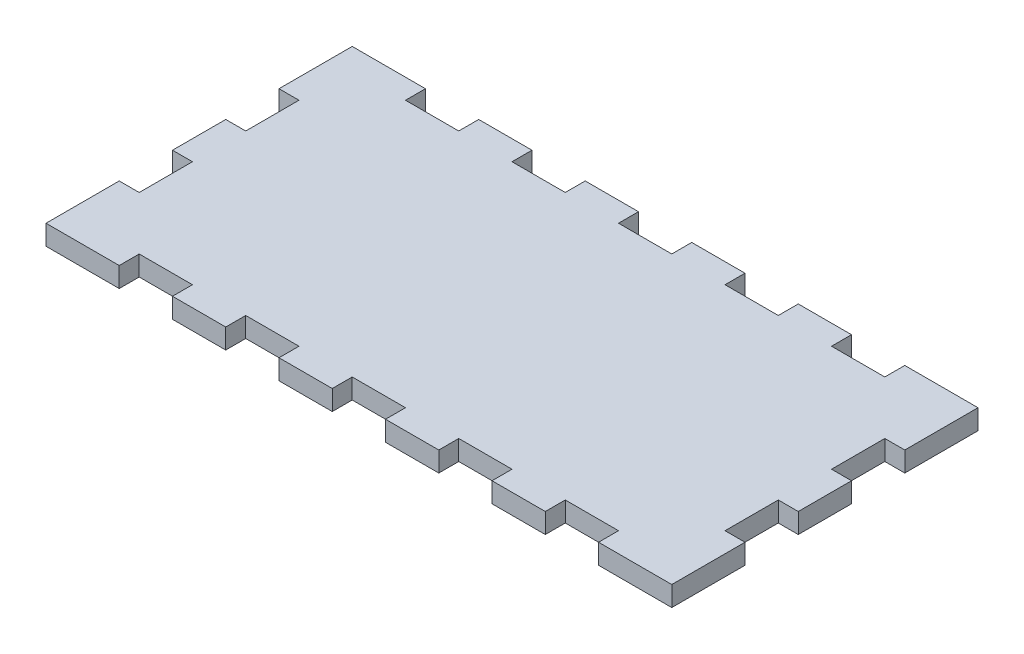
from build123d import *

# Parameters (mm, degrees)
SKETCH2_W               = 279.4
SKETCH2_H               = 127
BOSS_EXTRUDE1_DEPTH     = 9.525
SKETCH3_W               = 25.4
SKETCH3_H               = 9.525
BOSS_EXTRUDE2_DEPTH     = 9.525
LPATTERN1_COUNT         = 6
LPATTERN1_PITCH         = 50.8
MIRROR1_COPY_1_SKETCH_W = 25.4
MIRROR1_COPY_1_SKETCH_H = 9.525
MIRROR1_COPY_1_DEPTH    = 9.525
MIRROR1_COPY_2_SKETCH_W = 25.4
MIRROR1_COPY_2_SKETCH_H = 9.525
MIRROR1_COPY_2_DEPTH    = 9.525
MIRROR1_COPY_3_SKETCH_W = 25.4
MIRROR1_COPY_3_SKETCH_H = 9.525
MIRROR1_COPY_3_DEPTH    = 9.525
MIRROR1_COPY_4_SKETCH_W = 25.4
MIRROR1_COPY_4_SKETCH_H = 9.525
MIRROR1_COPY_4_DEPTH    = 9.525
MIRROR1_COPY_5_SKETCH_W = 25.4
MIRROR1_COPY_5_SKETCH_H = 9.525
MIRROR1_COPY_5_DEPTH    = 9.525
MIRROR1_COPY_6_SKETCH_W = 25.4
MIRROR1_COPY_6_SKETCH_H = 9.525
MIRROR1_COPY_6_DEPTH    = 9.525
SKETCH4_W               = 25.4
SKETCH4_H               = 9.525
BOSS_EXTRUDE3_DEPTH     = 9.525
LPATTERN2_COUNT         = 3
LPATTERN2_PITCH         = 50.8
MIRROR2_COPY_1_SKETCH_W = 25.4
MIRROR2_COPY_1_SKETCH_H = 9.525
MIRROR2_COPY_1_DEPTH    = 9.525
MIRROR2_COPY_2_SKETCH_W = 25.4
MIRROR2_COPY_2_SKETCH_H = 9.525
MIRROR2_COPY_2_DEPTH    = 9.525
MIRROR2_COPY_3_SKETCH_W = 25.4
MIRROR2_COPY_3_SKETCH_H = 9.525
MIRROR2_COPY_3_DEPTH    = 9.525
SKETCH6_W               = 9.525
SKETCH6_H               = 9.525
BOSS_EXTRUDE4_DEPTH     = 9.525
MIRROR4_COPY_1_SKETCH_W = 9.525
MIRROR4_COPY_1_SKETCH_H = 9.525
MIRROR4_COPY_1_DEPTH    = 9.525
MIRROR4_COPY_2_SKETCH_W = 9.525
MIRROR4_COPY_2_SKETCH_H = 9.525
MIRROR4_COPY_2_DEPTH    = 9.525


with BuildPart() as part:
    # Sketch2 → Boss-Extrude1 (new body)
    with BuildSketch(Plane(origin=(0, 0, 0), x_dir=(1, 0, 0), z_dir=(0, 1, 0))):
        Rectangle(SKETCH2_W, SKETCH2_H)
    extrude(amount=BOSS_EXTRUDE1_DEPTH)

    # Sketch3 → Boss-Extrude2 (add)
    with BuildSketch(Plane.XY.offset(63.5)):
        with Locations((-127, 4.7625)):
            Rectangle(SKETCH3_W, SKETCH3_H)
    boss_extrude2 = extrude(amount=BOSS_EXTRUDE2_DEPTH)

    # LPattern1: Boss-Extrude2 ×6
    with Locations(*[(i * LPATTERN1_PITCH, 0, 0) for i in range(1, LPATTERN1_COUNT)]):
        add(boss_extrude2)

    # Mirror1 copy 1 sketch → Mirror1 copy 1 (add)
    with BuildSketch(Plane(origin=(50.8, 0, -63.5), x_dir=(1, 0, 0), z_dir=(0, 0, -1))):
        with Locations((-127, -4.7625)):
            Rectangle(MIRROR1_COPY_1_SKETCH_W, MIRROR1_COPY_1_SKETCH_H)
    extrude(amount=MIRROR1_COPY_1_DEPTH)

    # Mirror1 copy 2 sketch → Mirror1 copy 2 (add)
    with BuildSketch(Plane(origin=(101.6, 0, -63.5), x_dir=(1, 0, 0), z_dir=(0, 0, -1))):
        with Locations((-127, -4.7625)):
            Rectangle(MIRROR1_COPY_2_SKETCH_W, MIRROR1_COPY_2_SKETCH_H)
    extrude(amount=MIRROR1_COPY_2_DEPTH)

    # Mirror1 copy 3 sketch → Mirror1 copy 3 (add)
    with BuildSketch(Plane(origin=(152.4, 0, -63.5), x_dir=(1, 0, 0), z_dir=(0, 0, -1))):
        with Locations((-127, -4.7625)):
            Rectangle(MIRROR1_COPY_3_SKETCH_W, MIRROR1_COPY_3_SKETCH_H)
    extrude(amount=MIRROR1_COPY_3_DEPTH)

    # Mirror1 copy 4 sketch → Mirror1 copy 4 (add)
    with BuildSketch(Plane(origin=(203.2, 0, -63.5), x_dir=(1, 0, 0), z_dir=(0, 0, -1))):
        with Locations((-127, -4.7625)):
            Rectangle(MIRROR1_COPY_4_SKETCH_W, MIRROR1_COPY_4_SKETCH_H)
    extrude(amount=MIRROR1_COPY_4_DEPTH)

    # Mirror1 copy 5 sketch → Mirror1 copy 5 (add)
    with BuildSketch(Plane(origin=(254, 0, -63.5), x_dir=(1, 0, 0), z_dir=(0, 0, -1))):
        with Locations((-127, -4.7625)):
            Rectangle(MIRROR1_COPY_5_SKETCH_W, MIRROR1_COPY_5_SKETCH_H)
    extrude(amount=MIRROR1_COPY_5_DEPTH)

    # Mirror1 copy 6 sketch → Mirror1 copy 6 (add)
    with BuildSketch(Plane(origin=(0, 0, -63.5), x_dir=(1, 0, 0), z_dir=(0, 0, -1))):
        with Locations((-127, -4.7625)):
            Rectangle(MIRROR1_COPY_6_SKETCH_W, MIRROR1_COPY_6_SKETCH_H)
    extrude(amount=MIRROR1_COPY_6_DEPTH)

    # Sketch4 → Boss-Extrude3 (add)
    with BuildSketch(Plane(origin=(139.7, 0, 0), x_dir=(0, 0, -1), z_dir=(1, 0, 0))):
        with Locations((-50.8, 4.7625)):
            Rectangle(SKETCH4_W, SKETCH4_H)
    boss_extrude3 = extrude(amount=BOSS_EXTRUDE3_DEPTH)

    # LPattern2: Boss-Extrude3 ×3
    with Locations(*[(0, 0, -i * LPATTERN2_PITCH) for i in range(1, LPATTERN2_COUNT)]):
        add(boss_extrude3)

    # Mirror2 copy 1 sketch → Mirror2 copy 1 (add)
    with BuildSketch(Plane(origin=(-139.7, 0, -50.8), x_dir=(0, 0, -1), z_dir=(-1, 0, 0))):
        with Locations((-50.8, -4.7625)):
            Rectangle(MIRROR2_COPY_1_SKETCH_W, MIRROR2_COPY_1_SKETCH_H)
    extrude(amount=MIRROR2_COPY_1_DEPTH)

    # Mirror2 copy 2 sketch → Mirror2 copy 2 (add)
    with BuildSketch(Plane(origin=(-139.7, 0, -101.6), x_dir=(0, 0, -1), z_dir=(-1, 0, 0))):
        with Locations((-50.8, -4.7625)):
            Rectangle(MIRROR2_COPY_2_SKETCH_W, MIRROR2_COPY_2_SKETCH_H)
    extrude(amount=MIRROR2_COPY_2_DEPTH)

    # Mirror2 copy 3 sketch → Mirror2 copy 3 (add)
    with BuildSketch(Plane(origin=(-139.7, 0, 0), x_dir=(0, 0, -1), z_dir=(-1, 0, 0))):
        with Locations((-50.8, -4.7625)):
            Rectangle(MIRROR2_COPY_3_SKETCH_W, MIRROR2_COPY_3_SKETCH_H)
    extrude(amount=MIRROR2_COPY_3_DEPTH)

    # Sketch6 → Boss-Extrude4 (add)
    with BuildSketch(Plane.XY.offset(63.5)):
        with Locations((144.4625, 4.7625)):
            Rectangle(SKETCH6_W, SKETCH6_H)
    boss_extrude4 = extrude(amount=BOSS_EXTRUDE4_DEPTH)

    # Mirror3: Boss-Extrude4 across plane
    add(boss_extrude4.mirror(Plane(origin=(0, 0, 0), x_dir=(0, 0, 1), z_dir=(1, 0, 0))))

    # Mirror4 copy 1 sketch → Mirror4 copy 1 (add)
    with BuildSketch(Plane(origin=(0, 0, -63.5), x_dir=(-1, 0, 0), z_dir=(0, 0, -1))):
        with Locations((144.4625, 4.7625)):
            Rectangle(MIRROR4_COPY_1_SKETCH_W, MIRROR4_COPY_1_SKETCH_H)
    extrude(amount=MIRROR4_COPY_1_DEPTH)

    # Mirror4 copy 2 sketch → Mirror4 copy 2 (add)
    with BuildSketch(Plane(origin=(0, 0, -63.5), x_dir=(1, 0, 0), z_dir=(0, 0, -1))):
        with Locations((144.4625, -4.7625)):
            Rectangle(MIRROR4_COPY_2_SKETCH_W, MIRROR4_COPY_2_SKETCH_H)
    extrude(amount=MIRROR4_COPY_2_DEPTH)


solid = part.part
